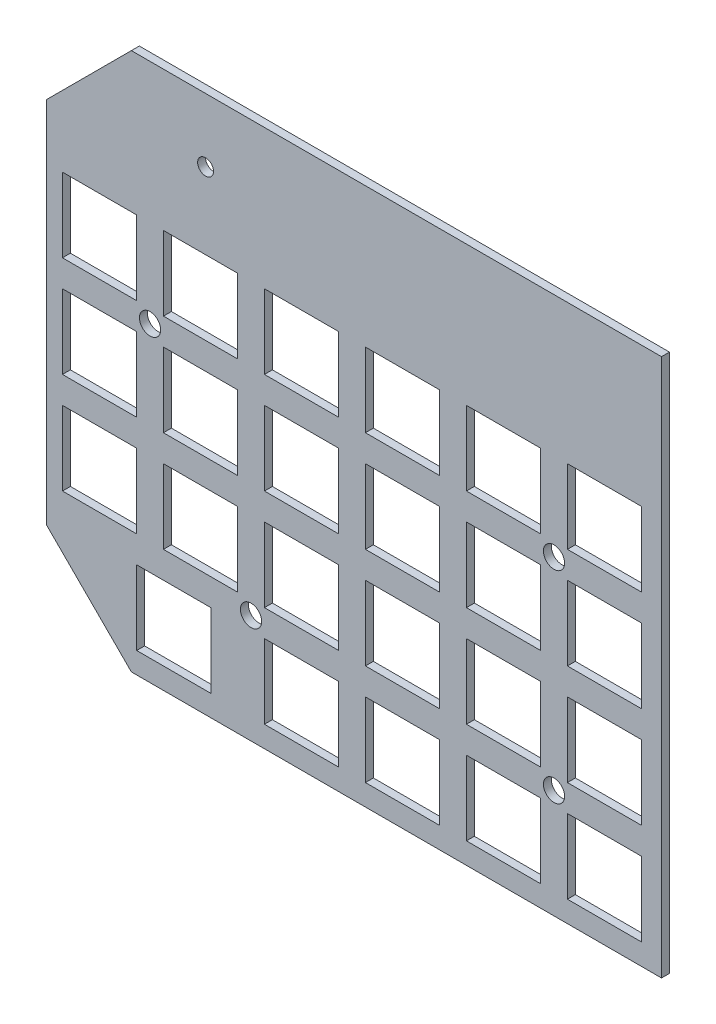
from build123d import *

# Parameters (mm, degrees)
BOSS_EXTRU_1_DEPTH      = 1.5
ESQUISSE2_R             = 2
ESQUISSE2_R_2           = 1.5
ESQUISSE2_W             = 14
ESQUISSE2_H             = 14
ENL_V_MAT_EXTRU_1_DEPTH = 1.5


with BuildPart() as part:
    # Esquisse1 → Boss.-Extru.1 (new body)
    with BuildSketch(Plane.XY):
        Polygon((0, -85), (16, -101), (116, -101), (116, 0.5), (16, 0.5), (0, -15.5), align=None)
    extrude(amount=BOSS_EXTRU_1_DEPTH)

    # Esquisse2 → Enlèv. mat.-Extru.1 (cut)
    with BuildSketch(Plane.XY.offset(1.5)):
        with Locations((19.525, -42.375)):
            Circle(ESQUISSE2_R)
        with Locations((95.725, -42.375)):
            Circle(ESQUISSE2_R)
        with Locations((95.725, -80.475)):
            Circle(ESQUISSE2_R)
        with Locations((38.575, -80.475)):
            Circle(ESQUISSE2_R)
        with Locations((30, -11.5)):
            Circle(ESQUISSE2_R_2)
        with Locations((10, -32.85)):
            Rectangle(ESQUISSE2_W, ESQUISSE2_H)
        with Locations((29.05, -32.85)):
            Rectangle(ESQUISSE2_W, ESQUISSE2_H)
        with Locations((48.1, -32.85)):
            Rectangle(ESQUISSE2_W, ESQUISSE2_H)
        with Locations((67.15, -32.85)):
            Rectangle(ESQUISSE2_W, ESQUISSE2_H)
        with Locations((86.2, -32.85)):
            Rectangle(ESQUISSE2_W, ESQUISSE2_H)
        with Locations((105.25, -32.85)):
            Rectangle(ESQUISSE2_W, ESQUISSE2_H)
        with Locations((29.05, -51.9)):
            Rectangle(ESQUISSE2_W, ESQUISSE2_H)
        with Locations((48.1, -51.9)):
            Rectangle(ESQUISSE2_W, ESQUISSE2_H)
        with Locations((67.15, -51.9)):
            Rectangle(ESQUISSE2_W, ESQUISSE2_H)
        with Locations((86.2, -51.9)):
            Rectangle(ESQUISSE2_W, ESQUISSE2_H)
        with Locations((105.25, -51.9)):
            Rectangle(ESQUISSE2_W, ESQUISSE2_H)
        with Locations((29.05, -70.95)):
            Rectangle(ESQUISSE2_W, ESQUISSE2_H)
        with Locations((48.1, -70.95)):
            Rectangle(ESQUISSE2_W, ESQUISSE2_H)
        with Locations((67.15, -70.95)):
            Rectangle(ESQUISSE2_W, ESQUISSE2_H)
        with Locations((86.2, -70.95)):
            Rectangle(ESQUISSE2_W, ESQUISSE2_H)
        with Locations((105.25, -70.95)):
            Rectangle(ESQUISSE2_W, ESQUISSE2_H)
        with Locations((10, -51.9)):
            Rectangle(ESQUISSE2_W, ESQUISSE2_H)
        with Locations((10, -70.95)):
            Rectangle(ESQUISSE2_W, ESQUISSE2_H)
        with Locations((48.1, -90)):
            Rectangle(ESQUISSE2_W, ESQUISSE2_H)
        with Locations((67.15, -90)):
            Rectangle(ESQUISSE2_W, ESQUISSE2_H)
        with Locations((86.2, -90)):
            Rectangle(ESQUISSE2_W, ESQUISSE2_H)
        with Locations((105.25, -90)):
            Rectangle(ESQUISSE2_W, ESQUISSE2_H)
        with Locations((24, -90)):
            Rectangle(ESQUISSE2_W, ESQUISSE2_H)
    extrude(amount=-ENL_V_MAT_EXTRU_1_DEPTH, mode=Mode.SUBTRACT)


solid = part.part
